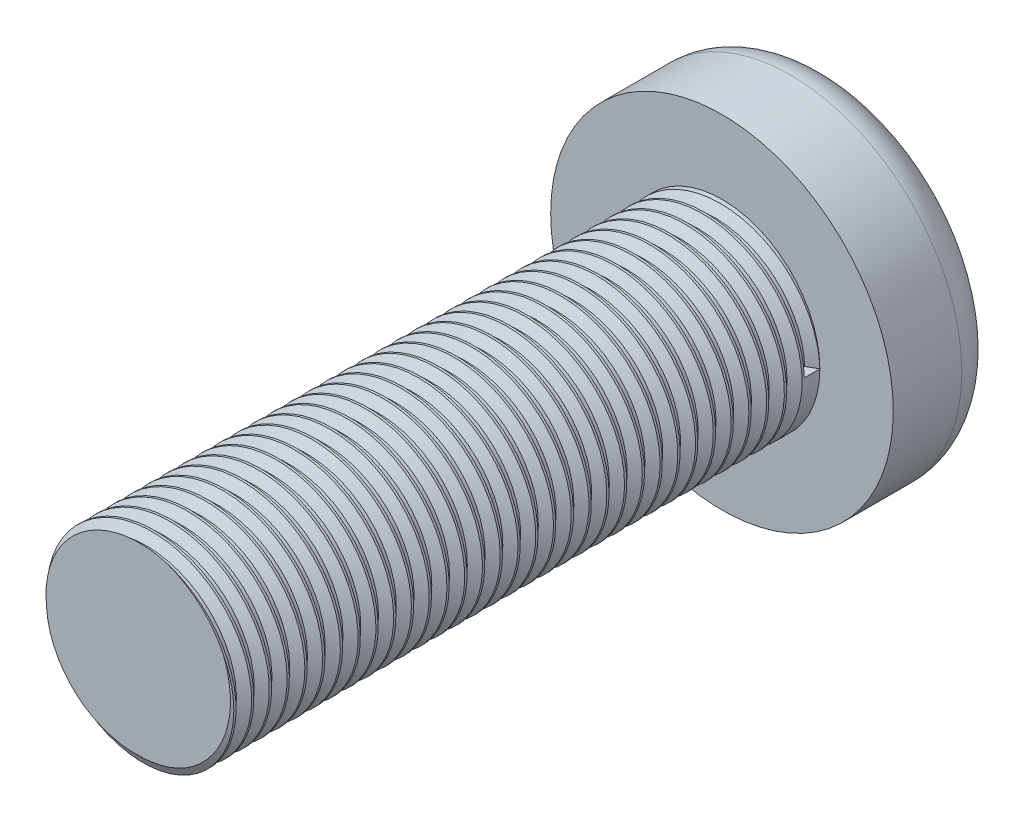
from build123d import *

# Parameters (mm, degrees)
SKETCH_1_R      = 5
EXTRUDE_1_DEPTH = 30
SKETCH_2_R      = 8.75
EXTRUDE_2_DEPTH = 5.5
FILLET_2_R      = 2
THREAD_1_PITCH  = 0.907142857


with BuildPart() as part:
    # 草图1 → 凸台-拉伸1 (new body)
    with BuildSketch(Plane.XY):
        Circle(SKETCH_1_R)
    extrude(amount=EXTRUDE_1_DEPTH)

    # Sketch 2 → 凸台-拉伸2 (add)
    with BuildSketch(Plane(origin=(0, 0, 0), x_dir=(-1, 0, 0), z_dir=(0, 0, -1))):
        Circle(SKETCH_2_R)
    extrude(amount=EXTRUDE_2_DEPTH)

    # 圆角2
    fillet_2_edges = [part.edges().sort_by_distance(p)[0] for p in [
        (8.75, 0, -5.5),
    ]]
    fillet(fillet_2_edges, radius=FILLET_2_R)

    # 螺纹线1: the profile of Sketch 2 2 profile screwed along a right-hand helix of 33.070866 turns, 8 arcs to a turn; built about Z, then put on its axis
    thread_1_z = Axis((0, 0, 0), (0, 0, 1))
    thread_1_corners = [(5.0003, 0, -0.000173205), (5.0003, 0, 0.793923203), (4.508994528, 0, 0.510267856), (4.508994528, 0, 0.283482142)]
    with BuildLine(mode=Mode.PRIVATE) as thread_1_profile:
        Line(thread_1_corners[0], thread_1_corners[1])
        Line(thread_1_corners[1], thread_1_corners[2])
        Line(thread_1_corners[2], thread_1_corners[3])
        Line(thread_1_corners[3], thread_1_corners[0])
    thread_1_cap = Face(thread_1_profile.wire())
    thread_1_turn_angles = [0, 22.5, 45, 67.5, 90, 112.5, 135, 157.5, 180, 202.5, 225, 247.5, 270, 292.5, 315, 337.5, 360]
    thread_1_turn_weights = [1, 0.9238795325112867, 1, 0.9238795325112867, 1, 0.9238795325112867, 1, 0.9238795325112867, 1, 0.9238795325112867, 1, 0.9238795325112867, 1, 0.9238795325112867, 1, 0.9238795325112867, 1]
    thread_1_turn_rails = [Edge.make_bspline([Vector(p[0], p[1], 0).rotate(thread_1_z, thread_1_turn_angles[k]) / thread_1_turn_weights[k] + Vector(0, 0, p[2] + THREAD_1_PITCH * thread_1_turn_angles[k] / 360) for k in range(17)], [0, 0, 0, 1, 1, 2, 2, 3, 3, 4, 4, 5, 5, 6, 6, 7, 7, 8, 8, 8], 2, thread_1_turn_weights) for p in thread_1_corners]
    thread_1_turn_sides = [Face.make_surface_from_curves(thread_1_turn_rails[p[0]], thread_1_turn_rails[p[1]]) for p in [(0, 1), (1, 2), (2, 3), (3, 0)]]
    thread_1_last_angles = [11880, 11892.755905512, 11905.511811024]
    thread_1_last_weights = [1, 0.9753195679051598, 1]
    thread_1_last_rails = [Edge.make_bspline([Vector(p[0], p[1], 0).rotate(thread_1_z, thread_1_last_angles[k]) / thread_1_last_weights[k] + Vector(0, 0, p[2] + THREAD_1_PITCH * thread_1_last_angles[k] / 360) for k in range(3)], [0, 0, 0, 1, 1, 1], 2, thread_1_last_weights) for p in thread_1_corners]
    thread_1_last_sides = [Face.make_surface_from_curves(thread_1_last_rails[p[0]], thread_1_last_rails[p[1]]) for p in [(0, 1), (1, 2), (2, 3), (3, 0)]]
    thread_1 = Plane(origin=(0, 0, 0), x_dir=(1, 0, 0), z_dir=(0, 0, 1)) * Solid(Shell([*[p.moved(Location((0, 0, THREAD_1_PITCH * i))) for i in range(33) for p in thread_1_turn_sides], *thread_1_last_sides, thread_1_cap, thread_1_cap.rotate(thread_1_z, 11905.511811024).moved(Location((0, 0, THREAD_1_PITCH * 11905.511811024 / 360)))]))
    add(thread_1, mode=Mode.SUBTRACT)


solid = part.part
